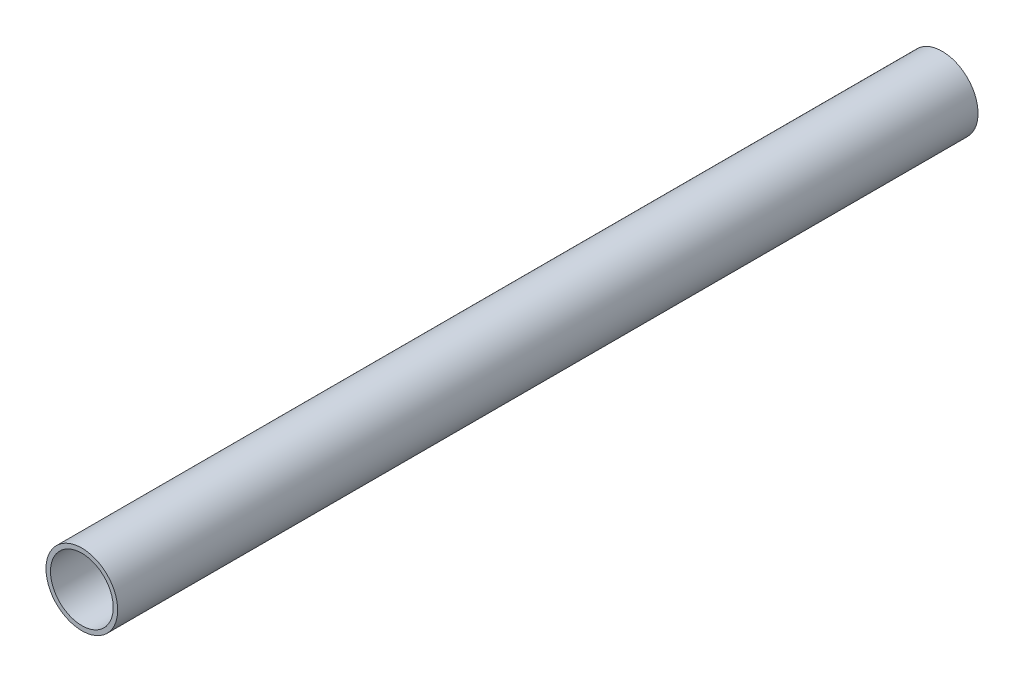
from build123d import *

# Parameters (mm, degrees)
SKETCH1_R           = 25.4
SKETCH1_R_2         = 22.225
BOSS_EXTRUDE1_DEPTH = 304.8


with BuildPart() as part:
    # Sketch1 → Boss-Extrude1 (new, symmetric)
    with BuildSketch(Plane.XY):
        Circle(SKETCH1_R)
        Circle(SKETCH1_R_2, mode=Mode.SUBTRACT)
    extrude(amount=BOSS_EXTRUDE1_DEPTH, both=True)


solid = part.part
